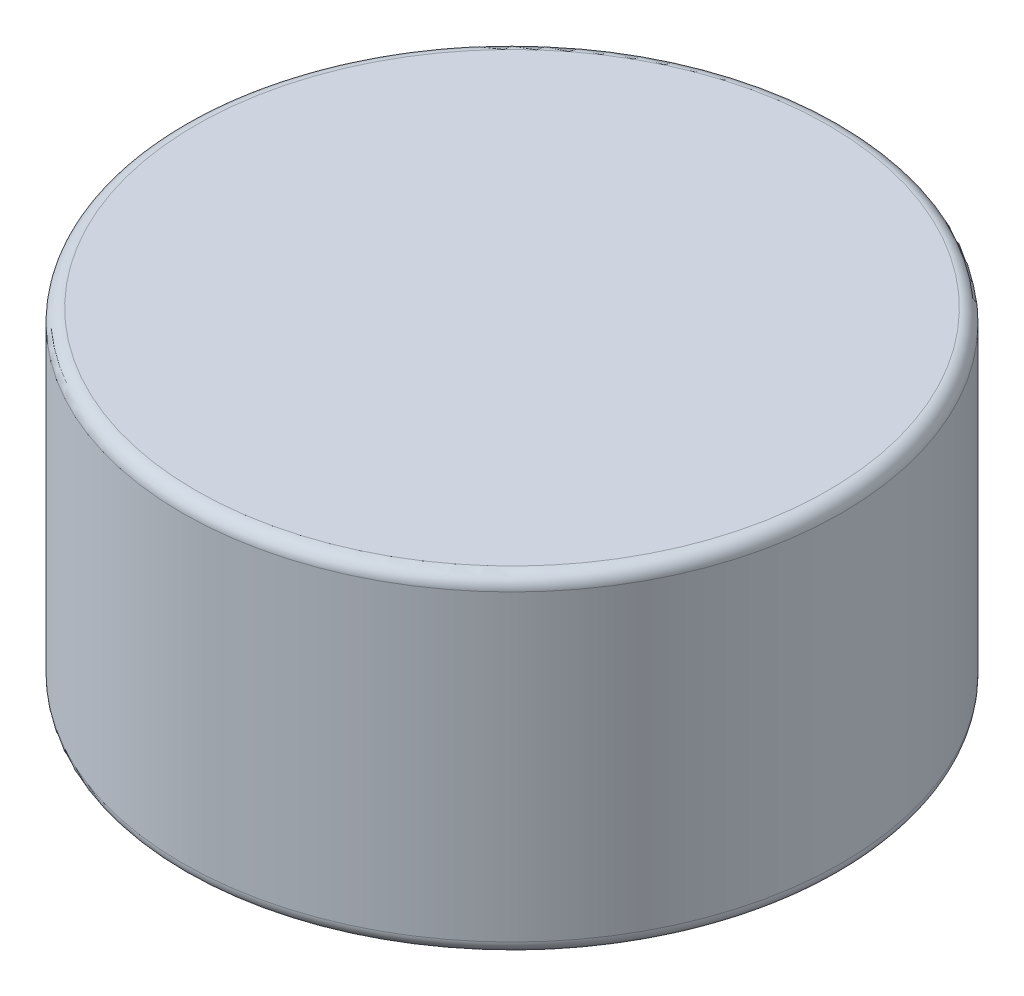
from build123d import *

# Parameters (mm, degrees)
SKETCH1_R           = 3.175
BOSS_EXTRUDE1_DEPTH = 1.5875
FILLET1_R           = 0.127


with BuildPart() as part:
    # Sketch1 → Boss-Extrude1 (new, symmetric)
    with BuildSketch(Plane(origin=(0, 0, 0), x_dir=(1, 0, 0), z_dir=(0, 1, 0))):
        Circle(SKETCH1_R)
    extrude(amount=BOSS_EXTRUDE1_DEPTH, both=True)

    # Fillet1
    fillet1_edges = [part.edges().sort_by_distance(p)[0] for p in [
        (-3.175, -1.5875, 0),
        (-3.175, 1.5875, 0),
    ]]
    fillet(fillet1_edges, radius=FILLET1_R)


solid = part.part
